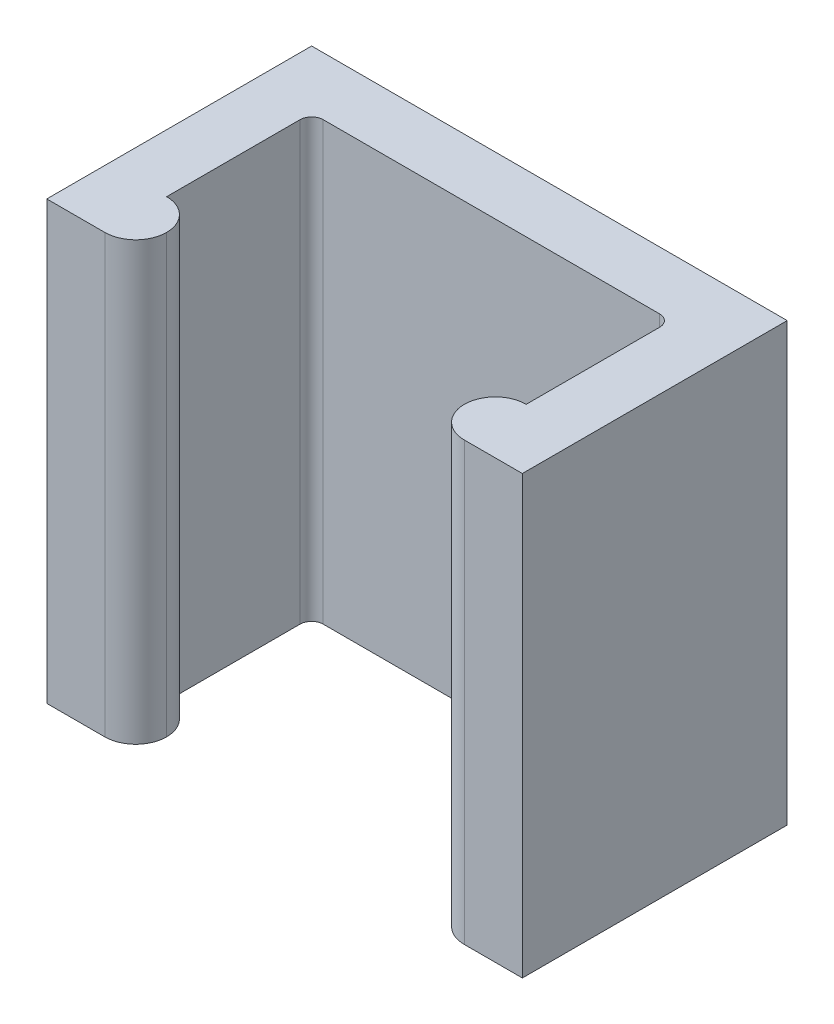
from build123d import *

# Parameters (mm, degrees)
SKETCH_1_W          = 12.3
SKETCH_1_H          = 11.3
EXTRUDE_1_DEPTH     = 2.5
SKETCH_2_W          = 1.5
SKETCH_2_H          = 11.3
EXTRUDE_2_DEPTH     = 4.35
SKETCH_5_W          = 9.3
SKETCH_5_H          = 11.5
CUT_EXTRUDE_1_DEPTH = 1
SKETCH_8_W          = 1.6
SKETCH_8_H          = 11.3
EXTRUDE_5_DEPTH     = 0.8
SKETCH_9_W          = 1.6
SKETCH_9_H          = 11.3
EXTRUDE_6_DEPTH     = 0.8
FILLET_7_R          = 0.8
FILLET_8_R          = 0.3


with BuildPart() as part:
    # 스케치1 → 보스-돌출1 (new body)
    with BuildSketch(Plane.XY):
        Rectangle(SKETCH_1_W, SKETCH_1_H)
    extrude(amount=EXTRUDE_1_DEPTH)

    # 스케치2 → 보스-돌출2 (add)
    with BuildSketch(Plane.XY.offset(2.5)):
        with Locations((-5.4, 0)):
            Rectangle(SKETCH_2_W, SKETCH_2_H)
        with Locations((5.4, 0)):
            Rectangle(SKETCH_2_W, SKETCH_2_H)
    extrude(amount=EXTRUDE_2_DEPTH)

    # 스케치5 → 컷-돌출1 (cut)
    with BuildSketch(Plane.XY.offset(2.5)):
        Rectangle(SKETCH_5_W, SKETCH_5_H)
    extrude(amount=-CUT_EXTRUDE_1_DEPTH, mode=Mode.SUBTRACT)

    # 스케치8 → 보스-돌출5 (add)
    with BuildSketch(Plane(origin=(-4.65, 0, 0), x_dir=(0, 0, -1), z_dir=(1, 0, 0))):
        with Locations((-6.05, 0)):
            Rectangle(SKETCH_8_W, SKETCH_8_H)
    extrude(amount=EXTRUDE_5_DEPTH)

    # 스케치9 → 보스-돌출6 (add)
    with BuildSketch(Plane.ZY.offset(-4.65)):
        with Locations((6.05, 0)):
            Rectangle(SKETCH_9_W, SKETCH_9_H)
    extrude(amount=EXTRUDE_6_DEPTH)

    # 필렛7
    fillet_7_edges = [part.edges().sort_by_distance(p)[0] for p in [
        (3.85, 0, 6.85),
        (-3.85, 0, 6.85),
        (3.85, 0, 5.25),
        (-3.85, 0, 5.25),
    ]]
    fillet(fillet_7_edges, radius=FILLET_7_R - 0.0001)  # a hair under: the kernel refuses the full size

    # 필렛8
    fillet_8_edges = [part.edges().sort_by_distance(p)[0] for p in [
        (4.65, 0, 1.5),
        (-4.65, 0, 1.5),
    ]]
    fillet(fillet_8_edges, radius=FILLET_8_R)


solid = part.part
